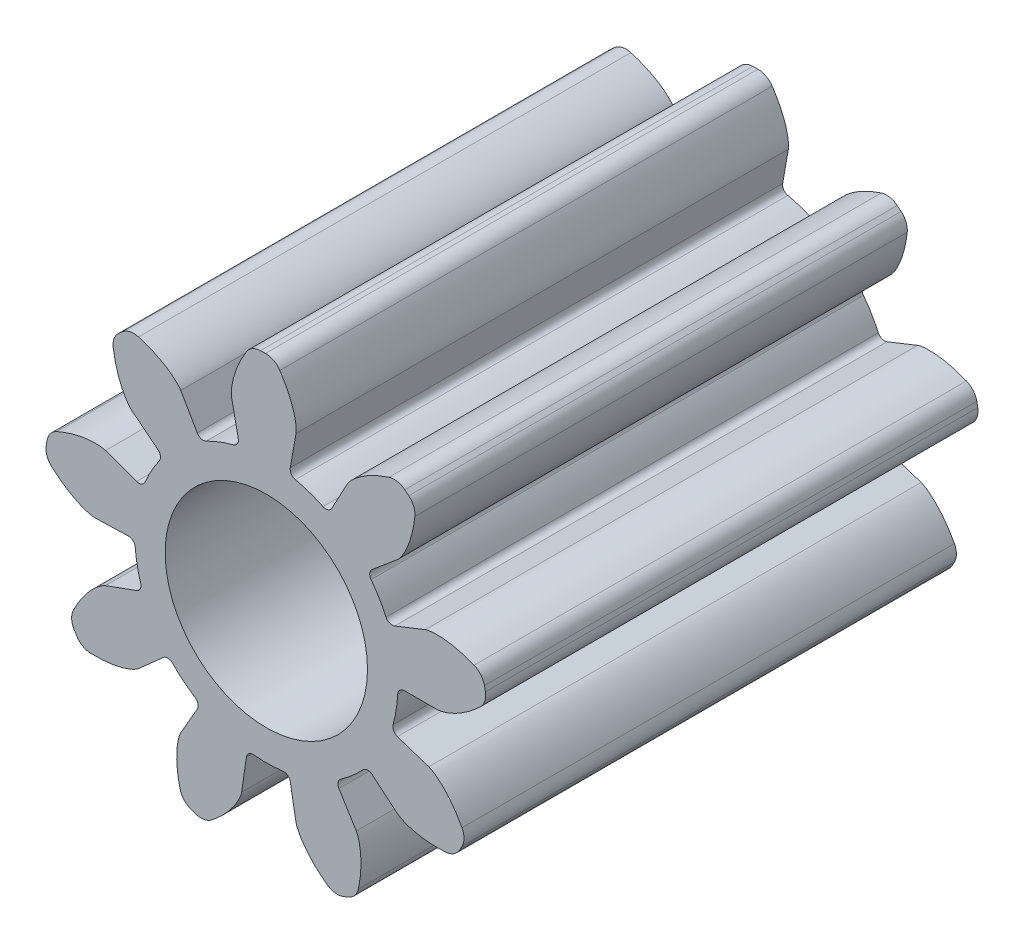
from build123d import *

# Parameters (mm, degrees)
SKETCH1_R                = 1.65
BOSS_EXTRUDE1_DEPTH      = 3.65
CUT_EXTRUDE3_START       = -3.65
CUT_EXTRUDE3_DEPTH       = 3.65
FILLET1_R                = 0.05
FILLET2_R                = 0.127
CIRPATTERN3_COUNT        = 9
FILLET1_OF_CIRPATTERN3_R = 0.05
FILLET2_OF_CIRPATTERN3_R = 0.127
SKETCH5_R                = 0.75
CUT_EXTRUDE4_DEPTH       = 7.212


# Read off the part's stored shape, not the designer's step: Cut-Extrude3
with BuildPart() as part:
    # Sketch1 → Boss-Extrude1 (new body)
    with BuildSketch(Plane.XY):
        Circle(SKETCH1_R)
    extrude(amount=-BOSS_EXTRUDE1_DEPTH)

    # Cut-Extrude3 outline → Cut-Extrude3 (cut)
    with BuildSketch(Plane.XY.offset(CUT_EXTRUDE3_START)):
        with BuildLine():
            add(Edge.make_bspline(
                [(1.480540337, -0.728354522), (1.477101767, -0.720620228), (1.469573903, -0.704152778), (1.457640153, -0.679875773), (1.440092834, -0.646825596), (1.42080558, -0.61413136), (1.400017708, -0.58190439), (1.378249206, -0.551484113), (1.357948774, -0.525733496), (1.339695767, -0.504609389), (1.323906062, -0.487627265), (1.310473998, -0.474065365), (1.296596243, -0.460936718), (1.282260826, -0.448323387), (1.267455019, -0.436284459), (1.253413584, -0.42586002), (1.240261137, -0.416978061), (1.228782765, -0.409988774), (1.219692037, -0.40497871), (1.212387222, -0.401405587), (1.207825106, -0.399409052), (1.205366229, -0.398472916), (1.204481981, -0.398159712)],
                knots=[0.280307251, 0.280307251, 0.280307251, 0.280307251, 0.280307251, 0.328394301, 0.383126635, 0.43785898, 0.492591256, 0.547323565, 0.602055884, 0.652783571, 0.680149903, 0.707515961, 0.734882063, 0.762248421, 0.789614741, 0.816980391, 0.844236067, 0.862480777, 0.880559096, 0.894007228, 0.903714168, 0.909090916, 0.909090916, 0.909090916, 0.909090916, 0.909090916], degree=4))
            ThreePointArc((1.480540337, -0.728354522), (1.629022552, -0.262269945), (1.634329212, 0.226865661))
            add(Edge.make_bspline(
                [(1.268585038, 0), (1.269522907, 1.9847e-05), (1.27215135, 0.000136932), (1.277109572, 0.000600709), (1.285166731, 0.001700579), (1.29537056, 0.003604251), (1.308462583, 0.006637745), (1.323738125, 0.010942845), (1.340341858, 0.016433462), (1.358178064, 0.023217081), (1.375747931, 0.030693713), (1.393045002, 0.038803264), (1.410054883, 0.047464061), (1.430376747, 0.058632283), (1.454337448, 0.072960052), (1.481694198, 0.091037942), (1.511910458, 0.113088757), (1.541762693, 0.137162753), (1.570336795, 0.16215139), (1.597370598, 0.18802408), (1.616320933, 0.207328798), (1.628636901, 0.220601424), (1.634329212, 0.226865661)],
                knots=[0, 0, 0, 0, 0, 0.005376748, 0.015083688, 0.02853182, 0.046610139, 0.064854849, 0.092110525, 0.119476175, 0.146842495, 0.174208853, 0.201574955, 0.228941013, 0.256307345, 0.307035032, 0.361767351, 0.41649966, 0.471231936, 0.525964281, 0.580696615, 0.628783665, 0.628783665, 0.628783665, 0.628783665, 0.628783665], degree=4))
            Line((1.268585038, 0), (0.975, 0))
            ThreePointArc((0.975, 0), (0.962604236, -0.154977695), (0.925732132, -0.306014739))
            Line((0.925732132, -0.306014739), (1.204481981, -0.398159712))
        make_face()
    cut_extrude3 = extrude(amount=CUT_EXTRUDE3_DEPTH, mode=Mode.SUBTRACT)

    # Fillet1
    fillet1_edges = [part.edges().sort_by_distance(p)[0] for p in [
        (0.925732132, -0.306014739, -1.825),
        (0.975, 0, -1.825),
    ]]
    fillet(fillet1_edges, radius=FILLET1_R)

    # Fillet2
    fillet2_edges = [part.edges().sort_by_distance(p)[0] for p in [
        (1.480540337, -0.728354522, -1.825),
        (1.634329212, 0.226865661, -1.825),
    ]]
    fillet(fillet2_edges, radius=FILLET2_R)

    # CirPattern3: Cut-Extrude3 ×9 about axis
    cirpattern3_axis = Axis((0, 0, -3.65), (0, 0, 1))
    for i in range(1, CIRPATTERN3_COUNT):
        add(cut_extrude3.rotate(cirpattern3_axis, i * 360 / CIRPATTERN3_COUNT), mode=Mode.SUBTRACT)

    # Fillet1 of CirPattern3
    fillet1_of_cirpattern3_edges = [part.edges().sort_by_distance(p)[0] for p in [
        (0.905854438, 0.360628254, -1.825),
        (0.746893332, 0.626717919, -1.825),
        (0.462117385, 0.858529279, -1.825),
        (0.169306973, 0.960187559, -1.825),
        (-0.197849528, 0.954714913, -1.825),
        (-0.4875, 0.844374769, -1.825),
        (-0.765240448, 0.604178829, -1.825),
        (-0.916200305, 0.33346964, -1.825),
        (-0.974566858, -0.029059244, -1.825),
        (-0.916200305, -0.33346964, -1.825),
        (-0.727882604, -0.648700174, -1.825),
        (-0.4875, -0.844374769, -1.825),
        (-0.14061399, -0.964807083, -1.825),
        (0.169306973, -0.960187559, -1.825),
        (0.512449473, -0.829470035, -1.825),
        (0.746893332, -0.626717919, -1.825),
    ]]
    fillet(fillet1_of_cirpattern3_edges, radius=FILLET1_OF_CIRPATTERN3_R)

    # Fillet2 of CirPattern3
    fillet2_of_cirpattern3_edges = [part.edges().sort_by_distance(p)[0] for p in [
        (1.60233696, 0.39372105, -1.825),
        (1.106142375, 1.224315747, -1.825),
        (0.974382312, 1.331570167, -1.825),
        (0.060379228, 1.648894888, -1.825),
        (-0.109496649, 1.646362804, -1.825),
        (-1.013636032, 1.301937785, -1.825),
        (-1.142140911, 1.190803988, -1.825),
        (-1.613359726, 0.345789524, -1.825),
        (-1.640364747, 0.178054751, -1.825),
        (-1.458174475, -0.772157499, -1.825),
        (-1.371043688, -0.918008282, -1.825),
        (-0.62069318, -1.528803446, -1.825),
        (-0.460196049, -1.584525038, -1.825),
        (0.507217351, -1.57010527, -1.825),
        (0.665982436, -1.509624918, -1.825),
        (1.397795247, -0.876737389, -1.825),
    ]]
    fillet(fillet2_of_cirpattern3_edges, radius=FILLET2_OF_CIRPATTERN3_R)

    # Sketch5 → Cut-Extrude4 (cut)
    with BuildSketch(Plane.XY):
        Circle(SKETCH5_R)
    extrude(amount=-CUT_EXTRUDE4_DEPTH, mode=Mode.SUBTRACT)


solid = part.part
